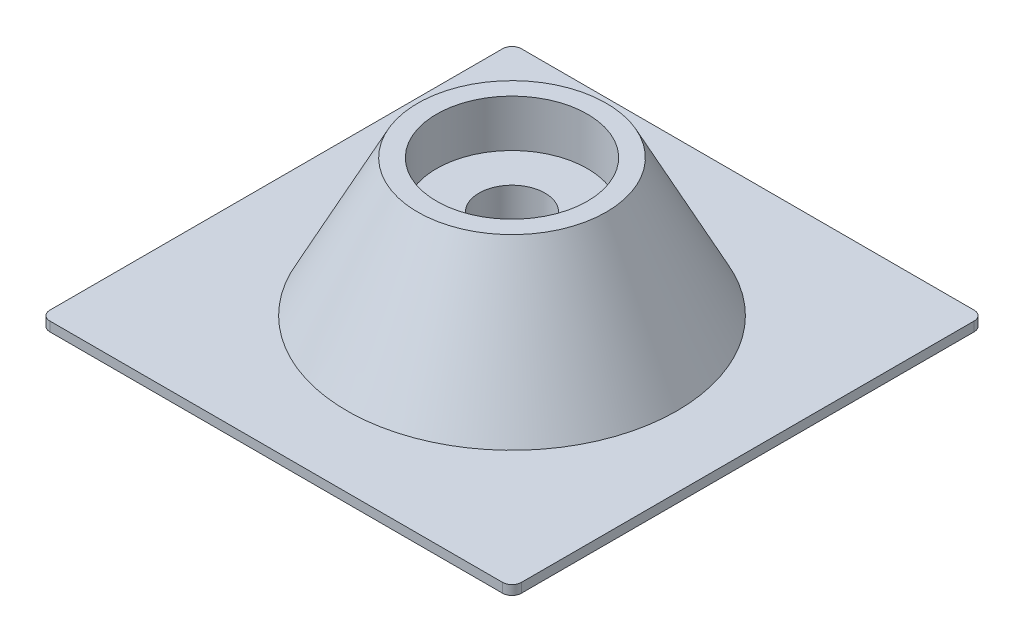
from build123d import *
from build123d.topology import SkipClean

# Parameters (mm, degrees)
BOSS_EXTRUDE1_DEPTH      = 0.5
BOSS_EXTRUDE1_DEPTH_BACK = 0.5
SKETCH1_R                = 3.5


with BuildPart() as part:
    # Sketch1 → Boss-Extrude1 (new, two sides: drawn at the far end of the back side and taken through both)
    with BuildSketch(Plane(origin=(0, 0, 0), x_dir=(1, 0, 0), z_dir=(0, 1, 0)).offset(-BOSS_EXTRUDE1_DEPTH_BACK)):
        with BuildLine():
            Line((-24, 25), (24, 25))
            ThreePointArc((24, 25), (24.707106781, 24.707106781), (25, 24))
            Line((25, 24), (25, -24))
            ThreePointArc((25, -24), (24.707106781, -24.707106781), (24, -25))
            Line((24, -25), (-24, -25))
            ThreePointArc((-24, -25), (-24.707106781, -24.707106781), (-25, -24))
            Line((-25, -24), (-25, 24))
            ThreePointArc((-25, 24), (-24.707106781, 24.707106781), (-24, 25))
        make_face()
        Circle(SKETCH1_R, mode=Mode.SUBTRACT)
    extrude(amount=BOSS_EXTRUDE1_DEPTH + BOSS_EXTRUDE1_DEPTH_BACK)

    # Sketch2 → Revolve1 (revolve)
    with SkipClean():  # the faces are left unmerged after this step: merging them gives an invalid solid
        with BuildSketch(Plane.XY):
            Polygon((-8, 15), (-10, 15), (-17.5, 0.5), (-3.5, 0.5), (-3.5, 10), (-8, 10), align=None)
        revolve(axis=Axis((0, 0.5, 0), (0, 1, 0)))
    add(part.part.scale(1), mode=Mode.REPLACE)  # the faces are merged on a copy


solid = part.part
